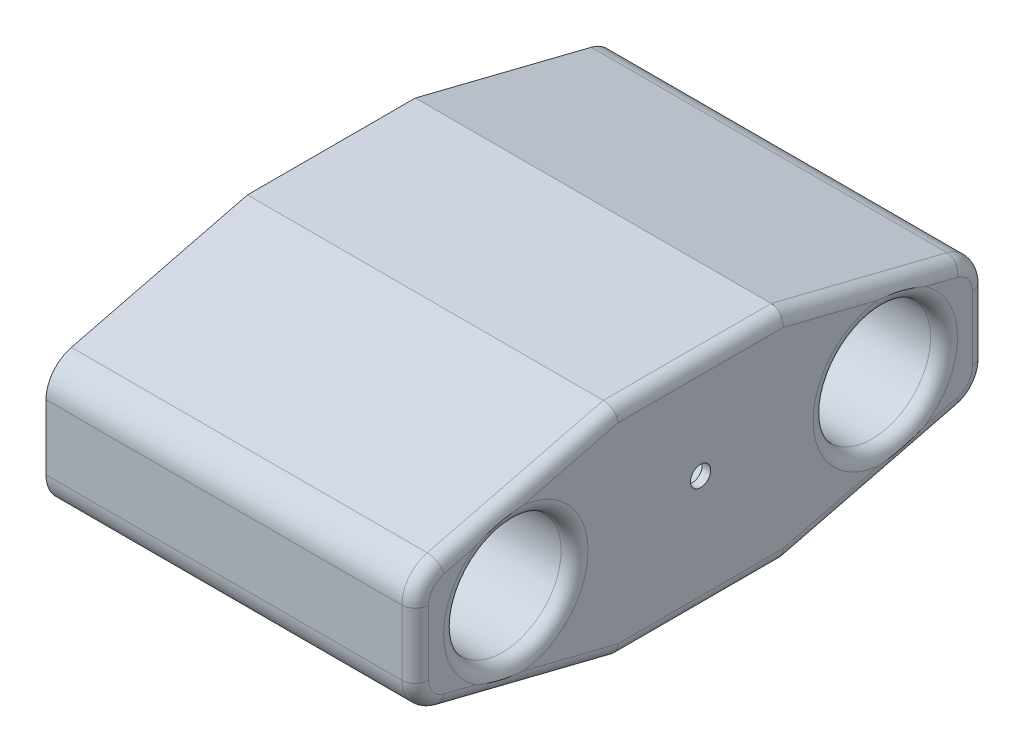
from build123d import *

# Parameters (mm, degrees)
BOSS_EXTRUDE1_DEPTH = 110
SKETCH2_R           = 17.5
CUT_EXTRUDE1_DEPTH  = 50
FILLET1_R           = 10
SHELL1_T            = -2.5
CUT_EXTRUDE4_DEPTH  = 5
FILLET2_R           = 4
SKETCH5_R           = 3
CUT_EXTRUDE5_DEPTH  = 20
SKETCH6_R           = 1.5
CUT_EXTRUDE6_DEPTH  = 20


with BuildPart() as part:
    # Sketch1 → Boss-Extrude1 (new body)
    with BuildSketch(Plane(origin=(0, 0, 0), x_dir=(0, 0, -1), z_dir=(1, 0, 0))):
        Polygon((-25, 25), (-85, 10), (-85, -25), (-25, -40), (25, -40), (85, -25), (85, 10), (25, 25), align=None)
    extrude(amount=-BOSS_EXTRUDE1_DEPTH)

    # Sketch2 → Cut-Extrude1 (cut)
    with BuildSketch(Plane(origin=(0, 0, 0), x_dir=(0, 0, -1), z_dir=(1, 0, 0))):
        with Locations((-55.041193262, -7.5)):
            Circle(SKETCH2_R)
    cut_extrude1 = extrude(amount=-CUT_EXTRUDE1_DEPTH, mode=Mode.SUBTRACT)

    # Fillet1
    fillet1_edges = [part.edges().sort_by_distance(p)[0] for p in [
        (-55, 10, -85),
        (-55, -25, -85),
        (-55, -25, 85),
        (-55, 10, 85),
    ]]
    fillet(fillet1_edges, radius=FILLET1_R)

    # Mirror1: Cut-Extrude1 across plane
    add(cut_extrude1.mirror(Plane.XY), mode=Mode.SUBTRACT)

    # Shell1
    shell1_openings = [part.faces().sort_by_distance(p)[0] for p in [
        (-110, -7.5, 0),
    ]]
    offset(amount=SHELL1_T, openings=shell1_openings, kind=Kind.INTERSECTION)

    # Sketch4 → Cut-Extrude4 (cut)
    with BuildSketch(Plane.ZY.offset(110)):
        with BuildLine():
            Line((-24.692235936, 23.5), (24.692235936, 23.5))
            Line((24.692235936, 23.5), (76.819017188, 10.468304687))
            ThreePointArc((76.819017188, 10.468304687), (81.623972971, 7.468623928), (83.5, 2.123887516))
            Line((83.5, 2.123887516), (83.5, -2.844969352))
            Line((83.5, -2.844969352), (83.5, -17.097430261))
            ThreePointArc((83.5, -17.097430261), (81.771400928, -22.367488253), (77.138058264, -25.416045575))
            Line((77.138058264, -25.416045575), (25.028869166, -38.5))
            Line((25.028869166, -38.5), (-24.692235936, -38.5))
            Line((-24.692235936, -38.5), (-77.034521995, -25.444807466))
            ThreePointArc((-77.034521995, -25.444807466), (-81.692018142, -22.419765778), (-83.5, -17.168637406))
            Line((-83.5, -17.168637406), (-83.5, -2.807764064))
            Line((-83.5, -2.807764064), (-83.5, 2.192235936))
            ThreePointArc((-83.5, 2.192235936), (-81.723124679, 7.497578438), (-76.981950719, 10.468304687))
            Line((-76.981950719, 10.468304687), (-24.692235936, 23.5))
        make_face()
        with BuildLine():
            Line((-24.692235936, 22.5), (24.692235936, 22.5))
            Line((24.692235936, 22.5), (76.819017188, 9.468304687))
            ThreePointArc((76.819017188, 9.468304687), (80.911540785, 6.807827506), (82.5, 2.192235936))
            Line((82.5, 2.192235936), (82.5, -17.192235936))
            ThreePointArc((82.5, -17.192235936), (80.911540785, -21.807827506), (76.819017188, -24.468304687))
            Line((76.819017188, -24.468304687), (24.692235936, -37.5))
            Line((24.692235936, -37.5), (-24.692235936, -37.5))
            Line((-24.692235936, -37.5), (-76.819017188, -24.468304687))
            ThreePointArc((-76.819017188, -24.468304687), (-80.911540785, -21.807827506), (-82.5, -17.192235936))
            Line((-82.5, -17.192235936), (-82.5, 2.192235936))
            ThreePointArc((-82.5, 2.192235936), (-80.911540785, 6.807827506), (-76.819017188, 9.468304687))
            Line((-76.819017188, 9.468304687), (-24.692235936, 22.5))
        make_face(mode=Mode.SUBTRACT)
    extrude(amount=-CUT_EXTRUDE4_DEPTH, mode=Mode.SUBTRACT)

    # Fillet2
    # the kernel refuses this fillet: 4 mm, written as the material it takes off along each edge
    with BuildSketch(Plane(origin=(0, 27.42535625, 15.298574999), x_dir=(-1, 0, 0), z_dir=(0, -0.2425356250363329, 0.970142500145332))) as fillet2_piece_1:
        with BuildLine():
            CenterArc((FILLET2_R, FILLET2_R), FILLET2_R, 180, 90)
            Line((0, FILLET2_R), (0, 0))
            Line((0, 0), (FILLET2_R, 0))
        make_face()
    extrude(amount=64.03882032, mode=Mode.SUBTRACT)
    with BuildSketch(Plane(origin=(0, 25, -35), x_dir=(0, -1, 0), z_dir=(0, 0, 1)), Plane(origin=(0, -40, 35), x_dir=(0, 1, 0), z_dir=(0, 0, -1))) as fillet2_piece_2:
        with BuildLine():
            CenterArc((FILLET2_R, -FILLET2_R), FILLET2_R, 90, 90)
            Line((0, -FILLET2_R), (0, 0))
            Line((0, 0), (FILLET2_R, 0))
        make_face()
    extrude(amount=70, mode=Mode.SUBTRACT)
    with BuildSketch(Plane(origin=(0, -7.5, 55.041193262), x_dir=(0, 0, -1), z_dir=(0, -1, 0))) as fillet2_piece_3:
        with BuildLine():
            CenterArc((17.5 + FILLET2_R, -FILLET2_R), FILLET2_R, 90, 90)
            Line((17.5, -FILLET2_R), (17.5, 0))
            Line((17.5, 0), (17.5 + FILLET2_R, 0))
        make_face()
    revolve(axis=Axis((0, -7.5, 55.041193262), (1, 0, 0)), mode=Mode.SUBTRACT)
    with BuildSketch(Plane(origin=(0, 2.192235936, 85), x_dir=(0, 0, -1), z_dir=(0, -1, 0)), Plane(origin=(0, -17.192235936, -85), x_dir=(0, 0, 1), z_dir=(0, 1, 0))) as fillet2_piece_4:
        with BuildLine():
            CenterArc((FILLET2_R, -FILLET2_R), FILLET2_R, 90, 90)
            Line((0, -FILLET2_R), (0, 0))
            Line((0, 0), (FILLET2_R, 0))
        make_face()
    extrude(amount=19.384471872, mode=Mode.SUBTRACT)
    with BuildSketch(Plane(origin=(0, -26.893660937, 77.42535625), x_dir=(0, 0.970142500145332, -0.24253562503633308), z_dir=(0, -0.24253562503633302, -0.9701425001453319)), Plane(origin=(0, 11.893660937, -77.42535625), x_dir=(0, -0.9701425001453319, 0.24253562503633322), z_dir=(0, 0.24253562503633322, 0.9701425001453319)), Plane(origin=(0, -42.42535625, -15.298574999), x_dir=(0, 0.9701425001453319, 0.2425356250363329), z_dir=(0, 0.24253562503633294, -0.970142500145332))) as fillet2_piece_5:
        with BuildLine():
            CenterArc((FILLET2_R, -FILLET2_R), FILLET2_R, 90, 90)
            Line((0, -FILLET2_R), (0, 0))
            Line((0, 0), (FILLET2_R, 0))
        make_face()
    extrude(amount=64.03882032, mode=Mode.SUBTRACT)
    with BuildSketch(Plane(origin=(0, 2.192235936, 75), x_dir=(0, 0.970142500145332, 0.2425356250363322), z_dir=(0, 0.2425356250363322, -0.970142500145332))) as fillet2_piece_6:
        with BuildLine():
            CenterArc((10 - FILLET2_R, -FILLET2_R), FILLET2_R, 0, 90)
            Line((10, -FILLET2_R), (10, 0))
            Line((10, 0), (10 - FILLET2_R, 0))
        make_face()
    revolve(axis=Axis((0, 2.192235936, 75), (1, 0, 0)), revolution_arc=75.963756532, mode=Mode.SUBTRACT)
    with BuildSketch(Plane(origin=(0, -17.192235936, 75), x_dir=(0, 0, 1), z_dir=(0, 1, 0))) as fillet2_piece_7:
        with BuildLine():
            CenterArc((10 - FILLET2_R, -FILLET2_R), FILLET2_R, 0, 90)
            Line((10, -FILLET2_R), (10, 0))
            Line((10, 0), (10 - FILLET2_R, 0))
        make_face()
    revolve(axis=Axis((0, -17.192235936, 75), (1, 0, 0)), revolution_arc=75.963756532, mode=Mode.SUBTRACT)
    with BuildSketch(Plane(origin=(0, 2.192235936, -75), x_dir=(0, 0.9701425001453317, -0.2425356250363336), z_dir=(0, 0.2425356250363336, 0.9701425001453317))) as fillet2_piece_8:
        with BuildLine():
            CenterArc((10 - FILLET2_R, FILLET2_R), FILLET2_R, 270, 90)
            Line((10, FILLET2_R), (10, 0))
            Line((10, 0), (10 - FILLET2_R, 0))
        make_face()
    revolve(axis=Axis((0, 2.192235936, -75), (-1, 0, 0)), revolution_arc=75.963756532, mode=Mode.SUBTRACT)
    with BuildSketch(Plane(origin=(0, -17.192235936, -75), x_dir=(0, 0, -1), z_dir=(0, 1, 0))) as fillet2_piece_9:
        with BuildLine():
            CenterArc((10 - FILLET2_R, FILLET2_R), FILLET2_R, 270, 90)
            Line((10, FILLET2_R), (10, 0))
            Line((10, 0), (10 - FILLET2_R, 0))
        make_face()
    revolve(axis=Axis((0, -17.192235936, -75), (-1, 0, 0)), revolution_arc=75.963756532, mode=Mode.SUBTRACT)
    with BuildSketch(Plane(origin=(0, -7.5, -55.041193262), x_dir=(0, 0, 1), z_dir=(0, -1, 0))) as fillet2_piece_10:
        with BuildLine():
            CenterArc((17.5 + FILLET2_R, FILLET2_R), FILLET2_R, 180, 90)
            Line((17.5, FILLET2_R), (17.5, 0))
            Line((17.5, 0), (17.5 + FILLET2_R, 0))
        make_face()
    revolve(axis=Axis((0, -7.5, -55.041193262), (-1, 0, 0)), mode=Mode.SUBTRACT)

    # Sketch5 → Cut-Extrude5 (cut)
    with BuildSketch(Plane(origin=(0, 0, 0), x_dir=(0, 0, -1), z_dir=(1, 0, 0))):
        with Locations((0, -5)):
            Circle(SKETCH5_R)
    extrude(amount=-CUT_EXTRUDE5_DEPTH, mode=Mode.SUBTRACT)

    # Sketch6 → Cut-Extrude6 (cut)
    with BuildSketch(Plane(origin=(-50, 0, 0), x_dir=(0, 0, -1), z_dir=(1, 0, 0))):
        with Locations((-55.041193262, -7.5)):
            Circle(SKETCH6_R)
    cut_extrude6 = extrude(amount=-CUT_EXTRUDE6_DEPTH, mode=Mode.SUBTRACT)

    # Mirror3: Cut-Extrude6 across plane
    add(cut_extrude6.mirror(Plane.XY), mode=Mode.SUBTRACT)


solid = part.part
